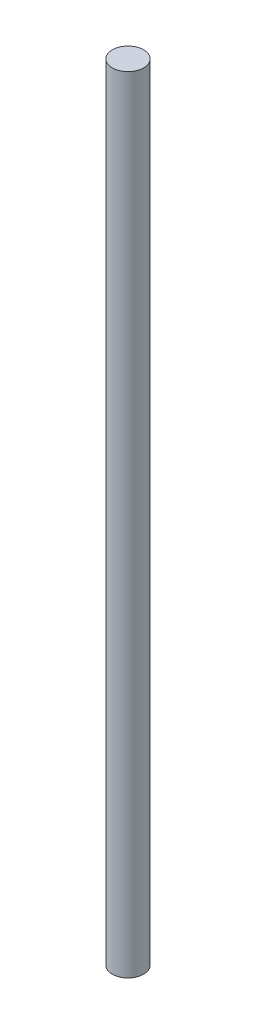
from build123d import *

# Parameters (mm, degrees)
SKETCH1_R           = 3
BOSS_EXTRUDE1_DEPTH = 150


with BuildPart() as part:
    # Sketch1 → Boss-Extrude1 (new body)
    with BuildSketch(Plane(origin=(0, 0, 0), x_dir=(1, 0, 0), z_dir=(0, 1, 0))):
        Circle(SKETCH1_R)
    extrude(amount=BOSS_EXTRUDE1_DEPTH)


solid = part.part
